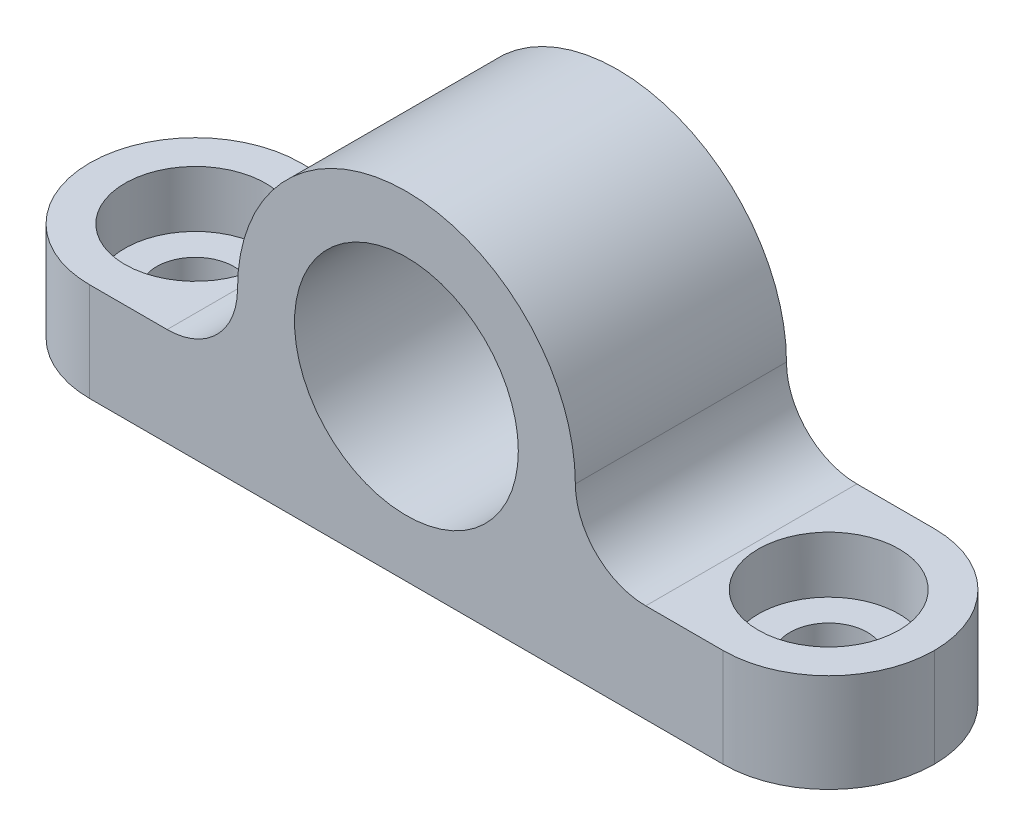
from build123d import *

# Parameters (mm, degrees)
SKETCH1_W           = 60
SKETCH1_H           = 15
BOSS_EXTRUDE1_DEPTH = 7
SKETCH2_R           = 2.75
CUT_EXTRUDE1_DEPTH  = 32.705677725
SKETCH3_R           = 5
CUT_EXTRUDE2_DEPTH  = 4
BOSS_EXTRUDE2_DEPTH = 15
SKETCH5_R           = 7.95
CUT_EXTRUDE3_DEPTH  = 42.243181255
FILLET2_R           = 7.5


with BuildPart() as part:
    # Sketch1 → Boss-Extrude1 (new body)
    with BuildSketch(Plane(origin=(0, 0, 0), x_dir=(1, 0, 0), z_dir=(0, 1, 0))):
        Rectangle(SKETCH1_W, SKETCH1_H)
    extrude(amount=BOSS_EXTRUDE1_DEPTH)

    # Sketch2 → Cut-Extrude1 (cut, through all)
    with BuildSketch(Plane(origin=(0, 7, 0), x_dir=(1, 0, 0), z_dir=(0, 1, 0))):
        with Locations(Location((-22.5, 0, 0), (0, 0, 270))):
            Circle(SKETCH2_R)
        with Locations(Location((22.5, 0, 0), (0, 0, 90))):
            Circle(SKETCH2_R)
    extrude(amount=-CUT_EXTRUDE1_DEPTH, mode=Mode.SUBTRACT)

    # Sketch3 → Cut-Extrude2 (cut)
    with BuildSketch(Plane(origin=(0, 7, 0), x_dir=(1, 0, 0), z_dir=(0, 1, 0))):
        with Locations(Location((-22.5, 0, 0), (0, 0, 270))):
            Circle(SKETCH3_R)
        with Locations(Location((22.5, 0, 0), (0, 0, 270))):
            Circle(SKETCH3_R)
    extrude(amount=-CUT_EXTRUDE2_DEPTH, mode=Mode.SUBTRACT)

    # Sketch4 → Boss-Extrude2 (add)
    with BuildSketch(Plane.XY.offset(7.5)):
        with BuildLine():
            Line((-17, 7), (17, 7))
            ThreePointArc((17, 7), (13.464466094, 8.464466094), (12, 12))
            ThreePointArc((12, 12), (0, 24), (-12, 12))
            ThreePointArc((-12, 12), (-13.464466094, 8.464466094), (-17, 7))
        make_face()
    extrude(amount=-BOSS_EXTRUDE2_DEPTH)

    # Sketch5 → Cut-Extrude3 (cut, through all)
    with BuildSketch(Plane.XY.offset(7.5)):
        with Locations((0, 12)):
            Circle(SKETCH5_R)
    extrude(amount=-CUT_EXTRUDE3_DEPTH, mode=Mode.SUBTRACT)

    # Fillet2
    fillet2_edges = [part.edges().sort_by_distance(p)[0] for p in [
        (30, 3.5, 7.5),
        (30, 3.5, -7.5),
        (-30, 3.5, -7.5),
        (-30, 3.5, 7.5),
    ]]
    fillet(fillet2_edges, radius=FILLET2_R - 0.0001)  # a hair under: the kernel refuses the full size


solid = part.part
